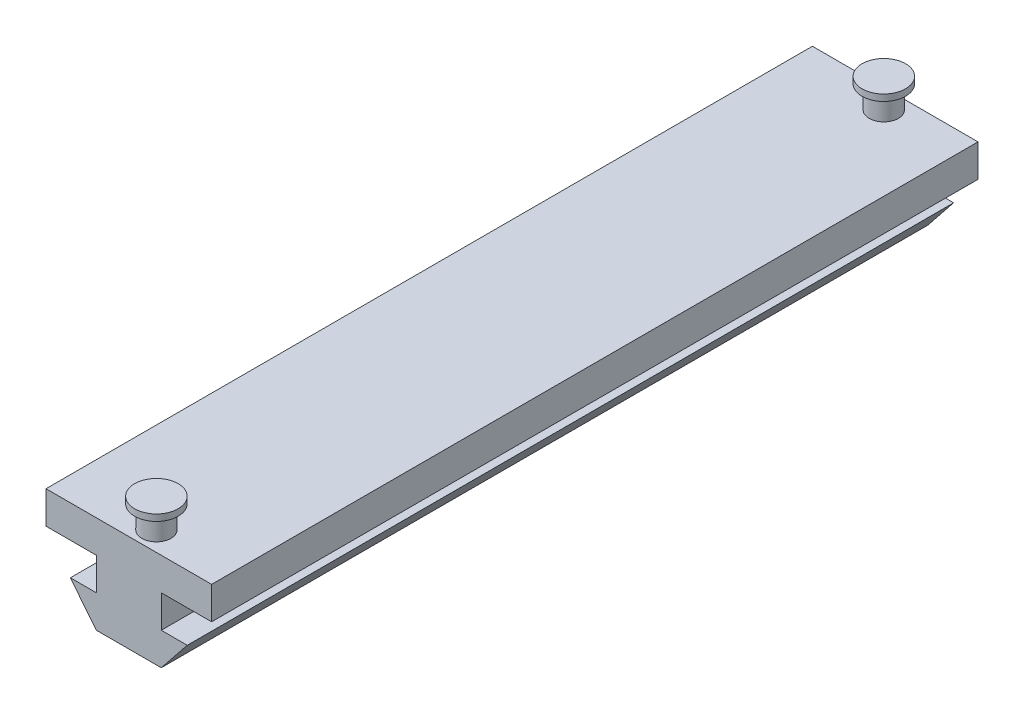
from build123d import *

# Parameters (mm, degrees)
SKETCH1_W           = 25.5
SKETCH1_H           = 118
BOSS_EXTRUDE1_DEPTH = 5
SKETCH2_R           = 2.25
BOSS_EXTRUDE2_DEPTH = 3.5
SKETCH3_R           = 3.35
BOSS_EXTRUDE3_DEPTH = 1
BOSS_EXTRUDE5_DEPTH = 118


with BuildPart() as part:
    # Sketch1 → Boss-Extrude1 (new body)
    with BuildSketch(Plane(origin=(0, 0, 0), x_dir=(1, 0, 0), z_dir=(0, 1, 0))):
        Rectangle(SKETCH1_W, SKETCH1_H)
    extrude(amount=BOSS_EXTRUDE1_DEPTH)

    # Sketch2 → Boss-Extrude2 (add)
    with BuildSketch(Plane(origin=(0, 5, 0), x_dir=(1, 0, 0), z_dir=(0, 1, 0))):
        with Locations((1.25, 56)):
            Circle(SKETCH2_R)
        with Locations((1.25, -56)):
            Circle(SKETCH2_R)
    extrude(amount=BOSS_EXTRUDE2_DEPTH)

    # Sketch3 → Boss-Extrude3 (add)
    with BuildSketch(Plane(origin=(0, 8.5, 0), x_dir=(1, 0, 0), z_dir=(0, 1, 0))):
        with Locations((1.25, -56)):
            Circle(SKETCH3_R)
        with Locations((1.25, 56)):
            Circle(SKETCH3_R)
    extrude(amount=BOSS_EXTRUDE3_DEPTH)

    # Sketch5 → Boss-Extrude5 (add)
    with BuildSketch(Plane.XY.offset(59)):
        Polygon((-5, 0), (-5, -5), (-9, -5), (-5, -10), (5, -10), (9, -5), (5, -5), (5, 0), align=None)
    extrude(amount=-BOSS_EXTRUDE5_DEPTH)


solid = part.part
